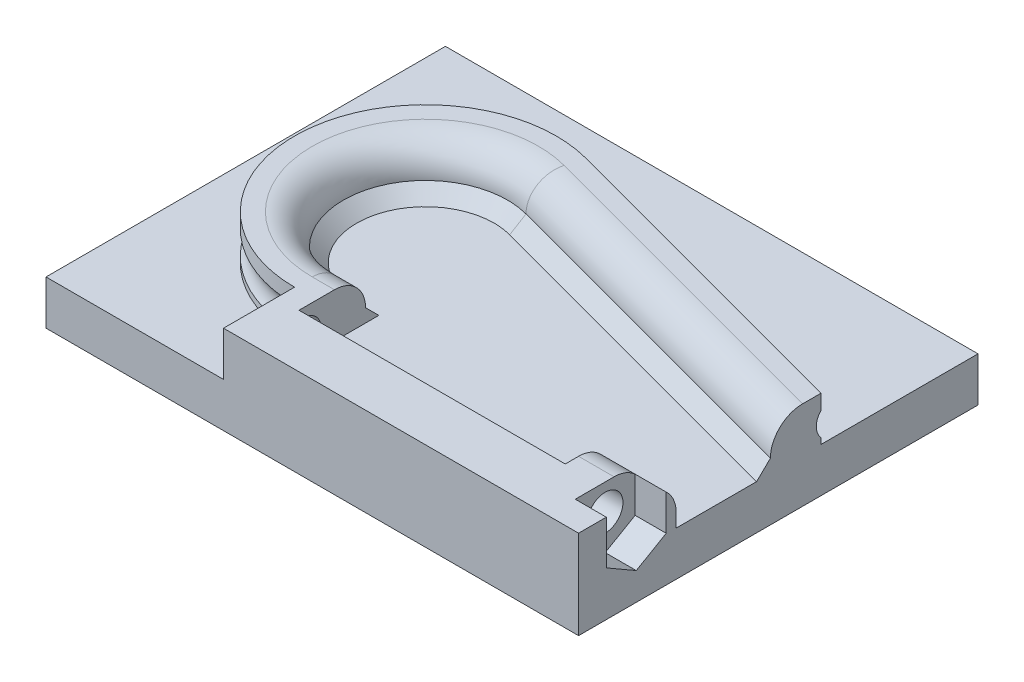
from build123d import *

# Parameters (mm, degrees)
SKETCH1_W           = 120
SKETCH1_H           = 90
BOSS_EXTRUDE1_DEPTH = 10
BOSS_EXTRUDE2_DEPTH = 10
SKETCH3_R           = 4
CUT_EXTRUDE1_DEPTH  = 10
CHAMFER2_SIZE       = 3
FILLET1_R           = 7
CUT_EXTRUDE2_DEPTH  = 7


with BuildPart() as part:
    # Sketch1 → Boss-Extrude1 (new body)
    with BuildSketch(Plane(origin=(0, 0, 0), x_dir=(1, 0, 0), z_dir=(0, 1, 0))):
        Rectangle(SKETCH1_W, SKETCH1_H)
    extrude(amount=BOSS_EXTRUDE1_DEPTH)

    # Sketch2 → Boss-Extrude2 (add)
    with BuildSketch(Plane(origin=(0, 10, 0), x_dir=(1, 0, 0), z_dir=(0, 1, 0))):
        with BuildLine():
            Line((60, -45), (-20, -45))
            Line((-20, -45), (-20, -29))
            ThreePointArc((-20, -29), (-49.247623411, 4.35052267), (-12.364838169, 28.994811876))
            Line((-12.364838169, 28.994811876), (60, 9.604711928))
            Line((60, 9.604711928), (60, -29))
            Line((60, -29), (60, -45))
        make_face()
    extrude(amount=BOSS_EXTRUDE2_DEPTH)

    # Cut-Sweep1: sweep along a path in Sketch4
    with BuildLine(Plane(origin=(0, 14, 0), x_dir=(1, 0, 0), z_dir=(0, 1, 0))) as cut_sweep1_path:
        Line((60, -32), (-20, -32))
        ThreePointArc((-20, -32), (-52.221957995, 4.742101247), (-11.588381034, 31.892589354))
        Line((-11.588381034, 31.892589354), (60, 12.710540469))
        Line((60, 12.710540469), (80.97534387, 7.090214018))
    # Sketch3 → Cut-Sweep1 (sweep, cut)
    with BuildSketch(Plane(origin=(60, 0, 0), x_dir=(0, 0, -1), z_dir=(1, 0, 0))):
        with Locations((-32, 14)):
            Circle(SKETCH3_R)
    sweep(path=cut_sweep1_path.line, mode=Mode.SUBTRACT)

    # Sketch5 → Cut-Extrude1 (cut)
    with BuildSketch(Plane(origin=(0, 20, 0), x_dir=(1, 0, 0), z_dir=(0, 1, 0))):
        with BuildLine():
            Line((-15, -18), (-15, -33))
            Line((-15, -33), (45, -33))
            Line((45, -33), (45, -23))
            Line((45, -23), (60, -23))
            Line((60, -23), (60, -1.783326057))
            Line((60, -1.783326057), (-15.211847666, 18.369627786))
            ThreePointArc((-15.211847666, 18.369627786), (-38.341729935, 2.914734556), (-20, -18))
            Line((-20, -18), (-15, -18))
        make_face()
    extrude(amount=-CUT_EXTRUDE1_DEPTH, mode=Mode.SUBTRACT)

    # Chamfer2
    chamfer2_edges = [part.edges().sort_by_distance(p)[0] for p in [
        (22.394076167, 10, -8.293150865),
        (-17.5, 10, 18),
        (-38.341729935, 10, -2.914734556),
    ]]
    chamfer(chamfer2_edges, length=CHAMFER2_SIZE)

    # Fillet1
    fillet1_edges = [part.edges().sort_by_distance(p)[0] for p in [
        (-17.5, 20, 18),
        (-38.341729935, 20, -2.914734556),
        (22.394076167, 20, -8.293150865),
        (52.5, 20, 23),
    ]]
    fillet(fillet1_edges, radius=FILLET1_R - 0.0001)  # a hair under: the kernel refuses the full size

    # Sketch6 → Cut-Extrude2 (cut)
    with BuildSketch(Plane(origin=(60, 0, 0), x_dir=(0, 0, -1), z_dir=(1, 0, 0))):
        Polygon((-32, 6.205771366), (-25.25, 10.102885683), (-25.25, 20), (-38.75, 20), (-38.75, 10.102885683), align=None)
    extrude(amount=-CUT_EXTRUDE2_DEPTH, mode=Mode.SUBTRACT)


solid = part.part
